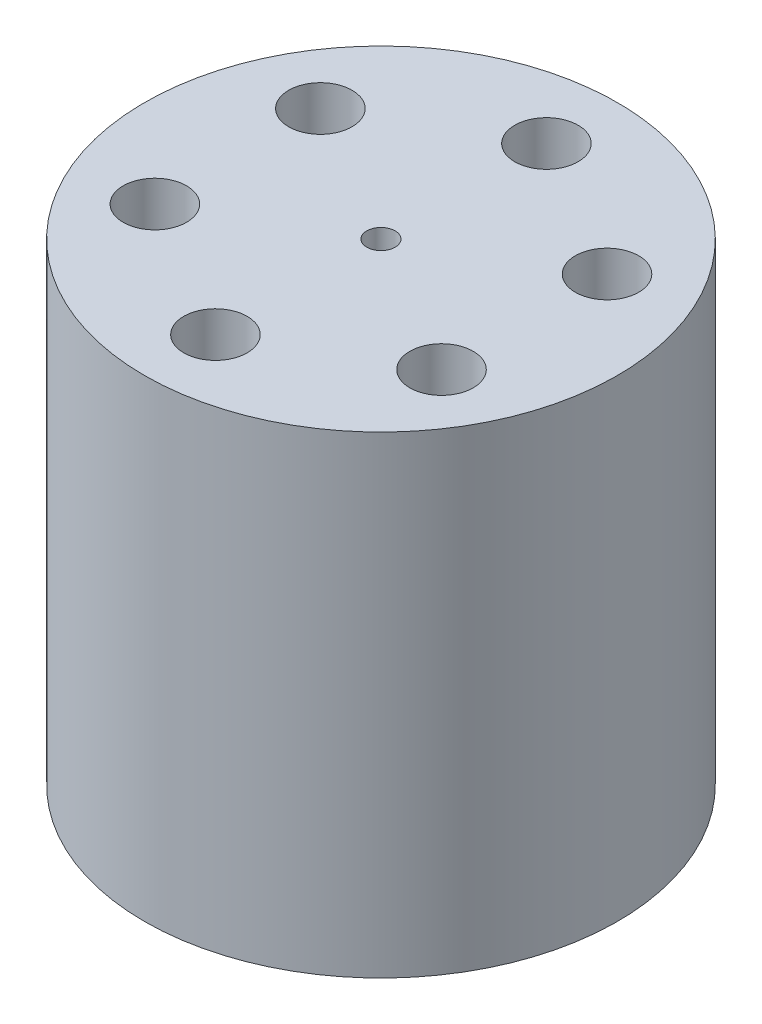
from build123d import *

# Parameters (mm, degrees)
SKETCH1_R           = 25
SKETCH1_R_2         = 3.35
SKETCH1_R_3         = 1.5
BOSS_EXTRUDE1_DEPTH = 50


with BuildPart() as part:
    # Sketch1 → Boss-Extrude1 (new body)
    with BuildSketch(Plane(origin=(0, 0, 0), x_dir=(1, 0, 0), z_dir=(0, 1, 0))):
        Circle(SKETCH1_R)
        with Locations((0, 17.5)):
            Circle(SKETCH1_R_2, mode=Mode.SUBTRACT)
        with Locations((15.155444566, 8.75)):
            Circle(SKETCH1_R_2, mode=Mode.SUBTRACT)
        with Locations((15.155444566, -8.75)):
            Circle(SKETCH1_R_2, mode=Mode.SUBTRACT)
        with Locations((0, -17.5)):
            Circle(SKETCH1_R_2, mode=Mode.SUBTRACT)
        with Locations((-15.155444566, -8.75)):
            Circle(SKETCH1_R_2, mode=Mode.SUBTRACT)
        with Locations((-15.155444566, 8.75)):
            Circle(SKETCH1_R_2, mode=Mode.SUBTRACT)
        Circle(SKETCH1_R_3, mode=Mode.SUBTRACT)
    extrude(amount=BOSS_EXTRUDE1_DEPTH)


solid = part.part
